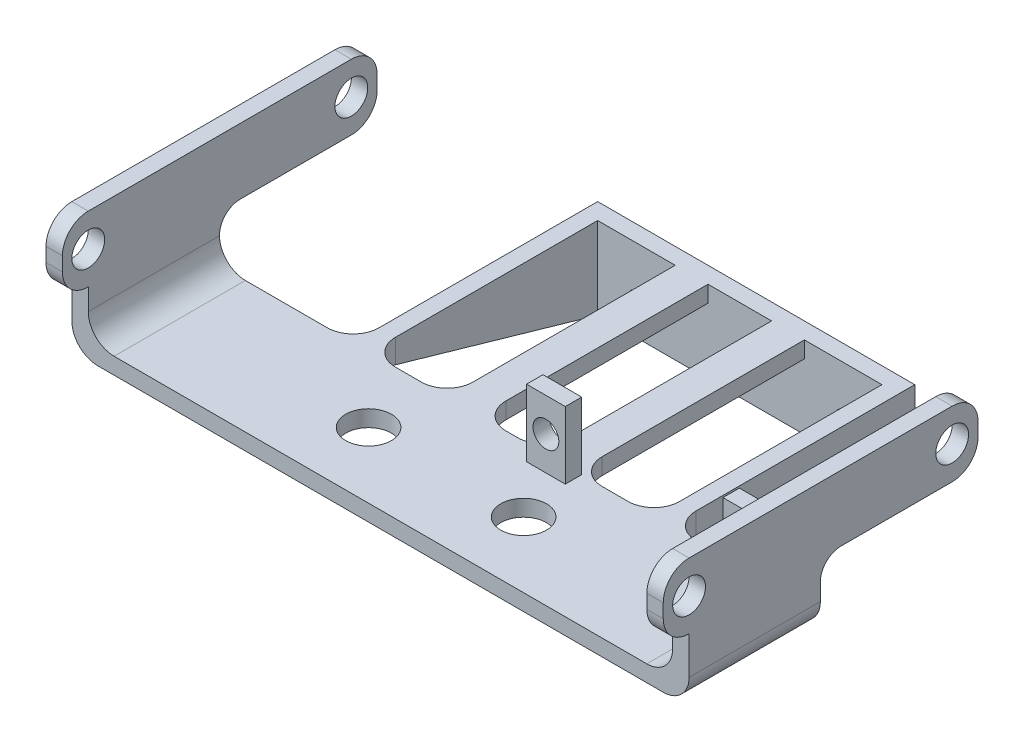
from build123d import *
from OCP.BRepFilletAPI import BRepFilletAPI_MakeFillet

# Parameters (mm, degrees)
SKETCH1_W              = 119.42
SKETCH1_H              = 25.4
BOSS_EXTRUDE1_DEPTH    = 3.175
SKETCH2_R              = 3.175
SKETCH2_W              = 25.4
SKETCH2_H              = 3.175
BOSS_EXTRUDE3_DEPTH    = 3.175
FILLET2_R              = 5
FILLET2_R_2            = 4
FILLET2_OF_MIRROR3_R   = 5
FILLET2_OF_MIRROR3_R_2 = 4
FILLET3_R              = 5
SKETCH3_R              = 4.425
CUT_EXTRUDE1_DEPTH     = 10
BOSS_EXTRUDE4_DEPTH    = 3.175
SKETCH9_W              = 55
SKETCH9_H              = 15.875
SKETCH9_R              = 1.5
BOSS_EXTRUDE7_DEPTH    = 3.175
BOSS_EXTRUDE8_DEPTH    = 3.175
FILLET4_R              = 5
SKETCH11_W             = 7.5
SKETCH11_H             = 3.175
BOSS_EXTRUDE9_DEPTH    = 13
SKETCH12_R             = 2.5
CUT_EXTRUDE2_DEPTH     = 10


with BuildPart() as part:
    # Sketch1 → Boss-Extrude1 (new body)
    with BuildSketch(Plane(origin=(0, 0, 0), x_dir=(1, 0, 0), z_dir=(0, 1, 0))):
        Rectangle(SKETCH1_W, SKETCH1_H)
    extrude(amount=BOSS_EXTRUDE1_DEPTH)

    # Sketch2 → Boss-Extrude3 (add)
    # profile 1 of 2: a face of its own
    with BuildSketch(Plane(origin=(59.71, 0, 0), x_dir=(0, 0, -1), z_dir=(1, 0, 0))):
        Polygon((-12.7, 12.3), (-12.7, 3.175), (12.7, 3.175), (12.7, 12.3), (38.2, 12.3), (43.2, 12.3), (43.2, 25), (38.2, 25), (12.7, 25), (-12.7, 25), (-17.7, 25), (-17.7, 12.3), align=None)
        with Locations((-12.7, 18.65)):
            Circle(SKETCH2_R, mode=Mode.SUBTRACT)
        with Locations((38.2, 18.65)):
            Circle(SKETCH2_R, mode=Mode.SUBTRACT)
    # profile 2 of 2: a face of its own
    with BuildSketch(Plane(origin=(59.71, 0, 0), x_dir=(0, 0, -1), z_dir=(1, 0, 0))):
        with Locations((0, 1.5875)):
            Rectangle(SKETCH2_W, SKETCH2_H)
    boss_extrude3 = extrude(amount=-BOSS_EXTRUDE3_DEPTH)

    # Fillet2
    fillet2_edges_1 = [part.edges().sort_by_distance(p)[0] for p in [
        (58.1225, 25, -43.2),
        (58.1225, 12.3, -43.2),
        (58.1225, 12.3, 17.7),
        (58.1225, 25, 17.7),
    ]]
    fillet2_edges_2 = [part.edges().sort_by_distance(p)[0] for p in [
        (58.1225, 12.3, -12.7),
    ]]
    fillet2 = BRepFilletAPI_MakeFillet(part.part.solid().wrapped)
    for e in fillet2_edges_1:
        fillet2.Add(FILLET2_R - 0.0001, e.wrapped)
    for e in fillet2_edges_2:
        fillet2.Add(FILLET2_R_2 - 0.0001, e.wrapped)
    add(Compound.cast(fillet2.Shape()), mode=Mode.REPLACE)  # a hair under: the kernel refuses the full size

    # Mirror3: Boss-Extrude3 across plane
    add(boss_extrude3.mirror(Plane(origin=(0, 0, 0), x_dir=(0, 0, 1), z_dir=(1, 0, 0))))

    # Fillet2 of Mirror3
    fillet2_of_mirror3_edges_1 = [part.edges().sort_by_distance(p)[0] for p in [
        (-58.1225, 25, -43.2),
        (-58.1225, 12.3, -43.2),
        (-58.1225, 12.3, 17.7),
        (-58.1225, 25, 17.7),
    ]]
    fillet2_of_mirror3_edges_2 = [part.edges().sort_by_distance(p)[0] for p in [
        (-58.1225, 12.3, -12.7),
    ]]
    fillet2_of_mirror3 = BRepFilletAPI_MakeFillet(part.part.solid().wrapped)
    for e in fillet2_of_mirror3_edges_1:
        fillet2_of_mirror3.Add(FILLET2_OF_MIRROR3_R - 0.0001, e.wrapped)
    for e in fillet2_of_mirror3_edges_2:
        fillet2_of_mirror3.Add(FILLET2_OF_MIRROR3_R_2 - 0.0001, e.wrapped)
    add(Compound.cast(fillet2_of_mirror3.Shape()), mode=Mode.REPLACE)  # a hair under: the kernel refuses the full size

    # Fillet3
    fillet3_edges = [part.edges().sort_by_distance(p)[0] for p in [
        (56.535, 3.175, 0),
        (59.71, 0, 0),
        (-59.71, 0, 0),
        (-56.535, 3.175, 0),
    ]]
    fillet(fillet3_edges, radius=FILLET3_R)

    # Sketch3 → Cut-Extrude1 (cut)
    with BuildSketch(Plane(origin=(0, 3.175, 0), x_dir=(1, 0, 0), z_dir=(0, 1, 0))):
        with Locations(Location((-15, 0, 0), (0, 0, 270))):
            Circle(SKETCH3_R)
        with Locations(Location((15, 0, 0), (0, 0, 270))):
            Circle(SKETCH3_R)
    extrude(amount=-CUT_EXTRUDE1_DEPTH, mode=Mode.SUBTRACT)

    # Sketch4 → Boss-Extrude4 (add)
    with BuildSketch(Plane(origin=(0, 3.175, 0), x_dir=(1, 0, 0), z_dir=(0, 1, 0))):
        Polygon((-12.5, 60), (12.5, 60), (12.5, 12.7), (6.15, 12.7), (6.15, 19.05), (6.15, 56.825), (-6.15, 56.825), (-6.15, 22.225), (-6.15, 12.7), (-12.5, 12.7), align=None)
    extrude(amount=-BOSS_EXTRUDE4_DEPTH)

    # Sketch9 → Boss-Extrude7 (add)
    with BuildSketch(Plane(origin=(0, 0, -60), x_dir=(-1, 0, 0), z_dir=(0, 0, -1))):
        with Locations((0, -4.7625)):
            Rectangle(SKETCH9_W, SKETCH9_H)
        with Locations((-20, -6.35)):
            Circle(SKETCH9_R, mode=Mode.SUBTRACT)
        with Locations((20, -6.35)):
            Circle(SKETCH9_R, mode=Mode.SUBTRACT)
    extrude(amount=-BOSS_EXTRUDE7_DEPTH)

    # Sketch10 → Boss-Extrude8 (add)
    with BuildSketch(Plane(origin=(27.5, 0, 0), x_dir=(0, 0, -1), z_dir=(1, 0, 0))):
        Polygon((56.825, -12.7), (12.7, 0), (12.7, 3.175), (60, 3.175), (60, -12.7), align=None)
    boss_extrude8 = extrude(amount=BOSS_EXTRUDE8_DEPTH)

    # Mirror4: Boss-Extrude8 across plane
    add(boss_extrude8.mirror(Plane(origin=(0, 0, 0), x_dir=(0, 0, 1), z_dir=(1, 0, 0))))

    # Fillet4
    fillet4_edges = [part.edges().sort_by_distance(p)[0] for p in [
        (12.5, 1.5875, -12.7),
        (6.15, 1.5875, -12.7),
        (-6.15, 1.5875, -12.7),
        (-12.5, 1.5875, -12.7),
        (27.5, 1.5875, -12.7),
        (30.675, 1.5875, -12.7),
        (-30.675, 1.5875, -12.7),
        (-27.5, 1.5875, -12.7),
    ]]
    fillet(fillet4_edges, radius=FILLET4_R)

    # Sketch11 → Boss-Extrude9 (add)
    with BuildSketch(Plane(origin=(0, 3.175, 0), x_dir=(1, 0, 0), z_dir=(0, 1, 0))):
        with Locations((47.785, 11.1125)):
            Rectangle(SKETCH11_W, SKETCH11_H)
        with Locations((9.785, 11.1125)):
            Rectangle(SKETCH11_W, SKETCH11_H)
    extrude(amount=BOSS_EXTRUDE9_DEPTH)

    # Sketch12 → Cut-Extrude2 (cut)
    with BuildSketch(Plane.XY.offset(-9.525)):
        with Locations((9.785, 9.675)):
            Circle(SKETCH12_R)
        with Locations((47.785, 9.675)):
            Circle(SKETCH12_R)
    extrude(amount=-CUT_EXTRUDE2_DEPTH, mode=Mode.SUBTRACT)


solid = part.part
